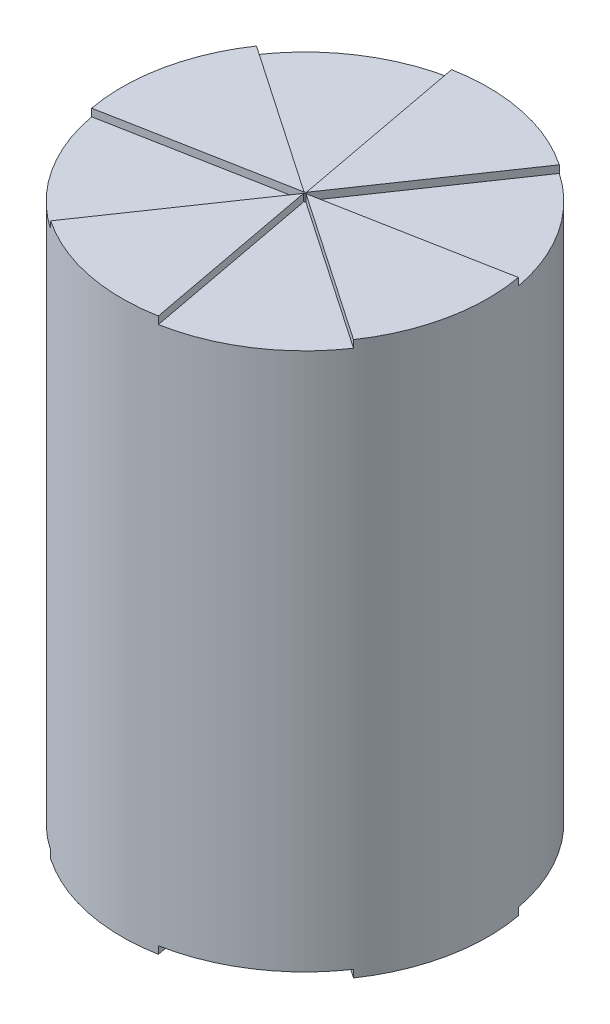
from build123d import *

# Parameters (mm, degrees)
SKETCH1_R            = 62.23
BOSS_EXTRUDE1_DEPTH  = 187.96
CUT_EXTRUDE7_START   = -2.54
CUT_EXTRUDE7_DEPTH   = 2.54
CIRPATTERN2_COUNT    = 4
MIRROR1_START        = -2.54
MIRROR1_COPY_1_DEPTH = 2.54
MIRROR1_COPY_2_DEPTH = 2.54
MIRROR1_COPY_3_DEPTH = 2.54
MIRROR1_COPY_4_DEPTH = 2.54


with BuildPart() as part:
    # Sketch1 → Boss-Extrude1 (new body)
    with BuildSketch(Plane(origin=(0, 0, 0), x_dir=(1, 0, 0), z_dir=(0, 1, 0))):
        Circle(SKETCH1_R)
    extrude(amount=BOSS_EXTRUDE1_DEPTH)

    # Sketch2 → Cut-Extrude7 (cut)
    with BuildSketch(Plane(origin=(0, 187.96, 0), x_dir=(1, 0, 0), z_dir=(0, 1, 0)).offset(CUT_EXTRUDE7_START)):
        with BuildLine():
            Line((-34.977816307, -51.46965384), (0.021593035, -0.253080503))
            ThreePointArc((0.021593035, -0.253080503), (-0.212652586, -0.138906004), (-0.223069042, 0.12147511))
            Line((-0.223069042, 0.12147511), (-61.186975042, -11.345791522))
            ThreePointArc((-61.186975042, -11.345791522), (-52.099883451, -34.031970915), (-34.977816307, -51.46965384))
        make_face()
    cut_extrude7 = extrude(amount=CUT_EXTRUDE7_DEPTH, mode=Mode.SUBTRACT)

    # CirPattern2: Cut-Extrude7 ×4 about axis
    cirpattern2_axis = Axis((0, 187.96, 0), (0, 1, 0))
    for i in range(1, CIRPATTERN2_COUNT):
        add(cut_extrude7.rotate(cirpattern2_axis, i * 360 / CIRPATTERN2_COUNT), mode=Mode.SUBTRACT)

    # Mirror1 copy 1 sketch → Mirror1 copy 1 (cut)
    with BuildSketch(Plane(origin=(0, 0, 0), x_dir=(0, 0, -1), z_dir=(0, -1, 0)).offset(MIRROR1_START)):
        with BuildLine():
            Line((-34.977816307, 51.46965384), (0.021593035, 0.253080503))
            ThreePointArc((0.021593035, 0.253080503), (-0.212652586, 0.138906004), (-0.223069042, -0.12147511))
            Line((-0.223069042, -0.12147511), (-61.186975042, 11.345791522))
            ThreePointArc((-61.186975042, 11.345791522), (-52.099883451, 34.031970915), (-34.977816307, 51.46965384))
        make_face()
    extrude(amount=MIRROR1_COPY_1_DEPTH, mode=Mode.SUBTRACT)

    # Mirror1 copy 2 sketch → Mirror1 copy 2 (cut)
    with BuildSketch(Plane(origin=(0, 0, 0), x_dir=(-1, 0, 0), z_dir=(0, -1, 0)).offset(MIRROR1_START)):
        with BuildLine():
            Line((-34.977816307, 51.46965384), (0.021593035, 0.253080503))
            ThreePointArc((0.021593035, 0.253080503), (-0.212652586, 0.138906004), (-0.223069042, -0.12147511))
            Line((-0.223069042, -0.12147511), (-61.186975042, 11.345791522))
            ThreePointArc((-61.186975042, 11.345791522), (-52.099883451, 34.031970915), (-34.977816307, 51.46965384))
        make_face()
    extrude(amount=MIRROR1_COPY_2_DEPTH, mode=Mode.SUBTRACT)

    # Mirror1 copy 3 sketch → Mirror1 copy 3 (cut)
    with BuildSketch(Plane(origin=(0, 0, 0), x_dir=(0, 0, 1), z_dir=(0, -1, 0)).offset(MIRROR1_START)):
        with BuildLine():
            Line((-34.977816307, 51.46965384), (0.021593035, 0.253080503))
            ThreePointArc((0.021593035, 0.253080503), (-0.212652586, 0.138906004), (-0.223069042, -0.12147511))
            Line((-0.223069042, -0.12147511), (-61.186975042, 11.345791522))
            ThreePointArc((-61.186975042, 11.345791522), (-52.099883451, 34.031970915), (-34.977816307, 51.46965384))
        make_face()
    extrude(amount=MIRROR1_COPY_3_DEPTH, mode=Mode.SUBTRACT)

    # Mirror1 copy 4 sketch → Mirror1 copy 4 (cut)
    with BuildSketch(Plane.XZ.offset(MIRROR1_START)):
        with BuildLine():
            Line((-34.977816307, 51.46965384), (0.021593035, 0.253080503))
            ThreePointArc((0.021593035, 0.253080503), (-0.212652586, 0.138906004), (-0.223069042, -0.12147511))
            Line((-0.223069042, -0.12147511), (-61.186975042, 11.345791522))
            ThreePointArc((-61.186975042, 11.345791522), (-52.099883451, 34.031970915), (-34.977816307, 51.46965384))
        make_face()
    extrude(amount=MIRROR1_COPY_4_DEPTH, mode=Mode.SUBTRACT)


solid = part.part
